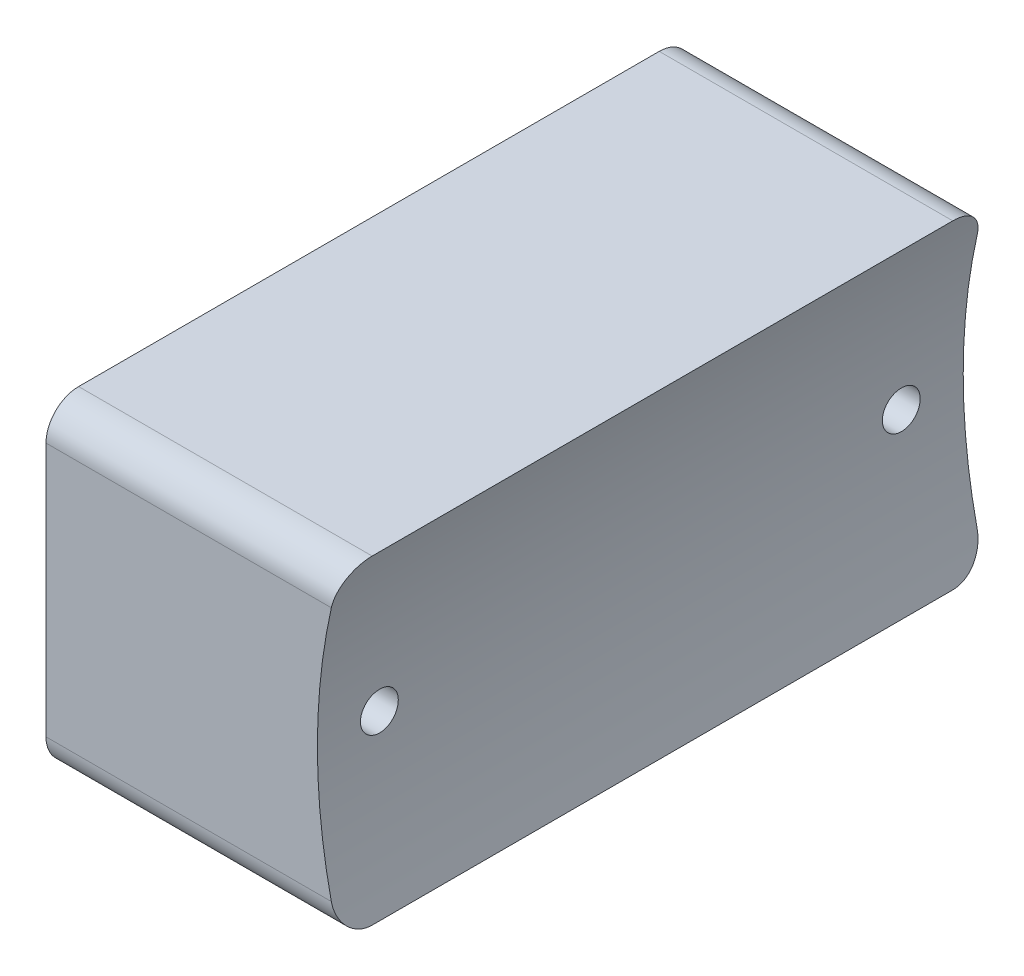
from build123d import *

# Parameters (mm, degrees)
SKETCH_1_W          = 49.5
SKETCH_1_H          = 24.5
EXTRUDE_1_DEPTH     = 22.5
SKETCH_2_R          = 2.5
CUT_EXTRUDE_1_DEPTH = 3
SKETCH_3_W          = 15.2
SKETCH_3_H          = 2.5
CUT_EXTRUDE_2_DEPTH = 8
CUT_EXTRUDE_3_DEPTH = 50
CUT_EXTRUDE_START   = 22.5
SKETCH_5_R          = 1.45
CUT_EXTRUDE_4_DEPTH = 10
FILLET_1_R          = 2.5


with BuildPart() as part:
    # Эскиз1 → Бобышка-Вытянуть1 (new body)
    with BuildSketch(Plane(origin=(0, 0, 0), x_dir=(0, 0, -1), z_dir=(1, 0, 0))):
        Rectangle(SKETCH_1_W, SKETCH_1_H)
    extrude(amount=EXTRUDE_1_DEPTH)

    # Эскиз2 → Вырез-Вытянуть1 (cut)
    with BuildSketch(Plane.ZY):
        with Locations((-20, -7.25)):
            Circle(SKETCH_2_R)
        with Locations((20, -7.25)):
            Circle(SKETCH_2_R)
    extrude(amount=-CUT_EXTRUDE_1_DEPTH, mode=Mode.SUBTRACT)

    # Эскиз3 → Вырез-Вытянуть2 (cut)
    with BuildSketch(Plane.ZY):
        with Locations((0, 8.75)):
            Rectangle(SKETCH_3_W, SKETCH_3_H)
    extrude(amount=-CUT_EXTRUDE_2_DEPTH, mode=Mode.SUBTRACT)

    # Эскиз4 → Вырез-Вытянуть3 (cut)
    with BuildSketch(Plane(origin=(0, 0, -24.75), x_dir=(-1, 0, 0), z_dir=(0, 0, -1))):
        with BuildLine():
            Line((-22.5, 12.25), (-22.5, -12.25))
            ThreePointArc((-22.5, -12.25), (-20.800548495, 0), (-22.5, 12.25))
        make_face()
    extrude(amount=-CUT_EXTRUDE_3_DEPTH, mode=Mode.SUBTRACT)

    # Эскиз5 → Вырез-Вытянуть4 (cut)
    with BuildSketch(Plane(origin=(0, 0, 0), x_dir=(0, 0, -1), z_dir=(1, 0, 0)).offset(CUT_EXTRUDE_START)):
        with Locations((-20, 0)):
            Circle(SKETCH_5_R)
        with Locations((20, 0)):
            Circle(SKETCH_5_R)
    extrude(amount=-CUT_EXTRUDE_4_DEPTH, mode=Mode.SUBTRACT)

    # Скругление1
    fillet_1_edges = [part.edges().sort_by_distance(p)[0] for p in [
        (11.25, -12.25, 24.75),
        (11.25, 12.25, 24.75),
        (11.25, -12.25, -24.75),
        (11.25, 12.25, -24.75),
    ]]
    fillet(fillet_1_edges, radius=FILLET_1_R)


solid = part.part
